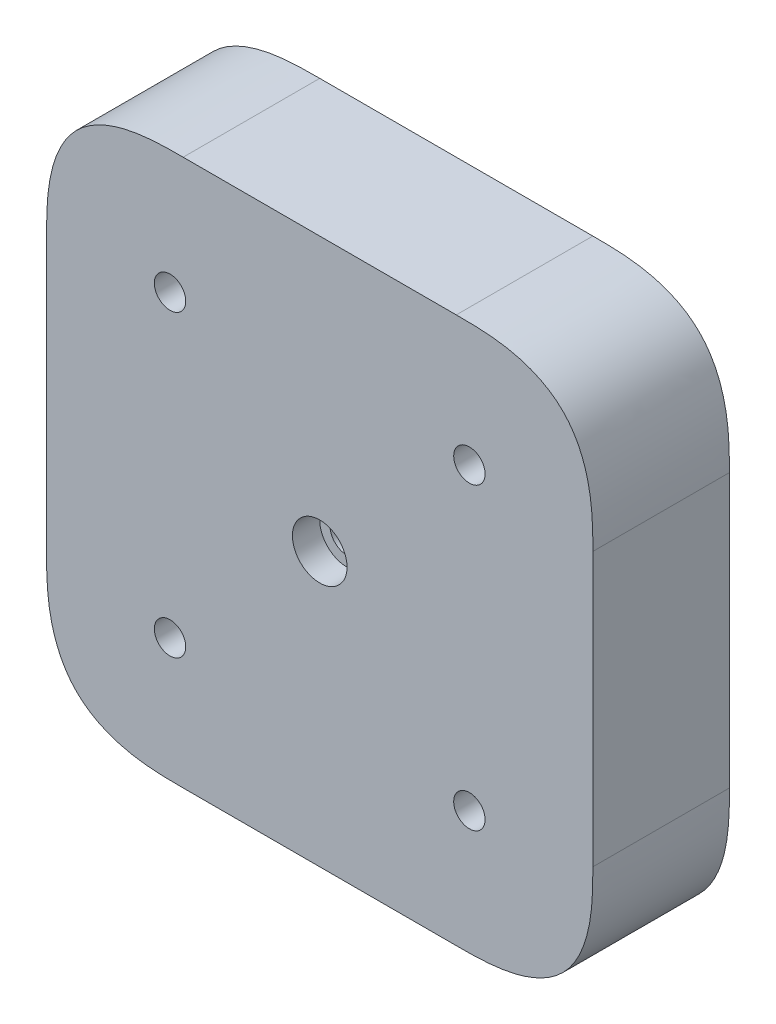
from build123d import *

# Parameters (mm, degrees)
ESQUISSE1_W             = 40
ESQUISSE1_H             = 40
ESQUISSE1_R             = 2
BOSS_EXTRU_1_DEPTH      = 10
ESQUISSE1_3_R           = 2
ESQUISSE1_3_R_2         = 1.25
BOSS_EXTRU_2_DEPTH      = 8
ENL_V_MAT_EXTRU_1_REACH = 59.446
ESQUISSE2_R             = 1.15
ESQUISSE2_5_R           = 3
ESQUISSE2_5_R_2         = 1.15
ENL_V_MAT_EXTRU_2_DEPTH = 4
CONG_1_SIZE             = 10


with BuildPart() as part:
    # Esquisse1 → Boss.-Extru.1 (new body)
    with BuildSketch(Plane.XY):
        with Locations((20, 20)):
            Rectangle(ESQUISSE1_W, ESQUISSE1_H)
        with Locations((20, 20)):
            Circle(ESQUISSE1_R, mode=Mode.SUBTRACT)
    extrude(amount=BOSS_EXTRU_1_DEPTH)

    # Esquisse1<3> → Boss.-Extru.2 (add)
    with BuildSketch(Plane.XY):
        with Locations((20, 20)):
            Circle(ESQUISSE1_3_R)
        with Locations((20, 20)):
            Circle(ESQUISSE1_3_R_2, mode=Mode.SUBTRACT)
    extrude(amount=BOSS_EXTRU_2_DEPTH)

    # Esquisse2 → Enlèv. mat.-Extru.1 (cut, up to next)
    with BuildSketch(Plane(origin=(0, 0, 0), x_dir=(-1, 0, 0), z_dir=(0, 0, -1)), mode=Mode.PRIVATE) as enl_v_mat_extru_1_sk1:
        with Locations((-9.039844892, 30.960155108)):
            Circle(ESQUISSE2_R)
    enl_v_mat_extru_1_tool1 = extrude(enl_v_mat_extru_1_sk1.sketch, amount=-ENL_V_MAT_EXTRU_1_REACH, mode=Mode.PRIVATE) & part.part
    # Esquisse2 → Enlèv. mat.-Extru.1 (cut, up to next)
    with BuildSketch(Plane(origin=(0, 0, 0), x_dir=(-1, 0, 0), z_dir=(0, 0, -1)), mode=Mode.PRIVATE) as enl_v_mat_extru_1_sk2:
        with Locations((-9.039844892, 9.039844892)):
            Circle(ESQUISSE2_R)
    enl_v_mat_extru_1_tool2 = extrude(enl_v_mat_extru_1_sk2.sketch, amount=-ENL_V_MAT_EXTRU_1_REACH, mode=Mode.PRIVATE) & part.part
    # Esquisse2 → Enlèv. mat.-Extru.1 (cut, up to next)
    with BuildSketch(Plane(origin=(0, 0, 0), x_dir=(-1, 0, 0), z_dir=(0, 0, -1)), mode=Mode.PRIVATE) as enl_v_mat_extru_1_sk3:
        with Locations((-30.960155108, 9.039844892)):
            Circle(ESQUISSE2_R)
    enl_v_mat_extru_1_tool3 = extrude(enl_v_mat_extru_1_sk3.sketch, amount=-ENL_V_MAT_EXTRU_1_REACH, mode=Mode.PRIVATE) & part.part
    # Esquisse2 → Enlèv. mat.-Extru.1 (cut, up to next)
    with BuildSketch(Plane(origin=(0, 0, 0), x_dir=(-1, 0, 0), z_dir=(0, 0, -1)), mode=Mode.PRIVATE) as enl_v_mat_extru_1_sk4:
        with Locations((-30.960155108, 30.960155108)):
            Circle(ESQUISSE2_R)
    enl_v_mat_extru_1_tool4 = extrude(enl_v_mat_extru_1_sk4.sketch, amount=-ENL_V_MAT_EXTRU_1_REACH, mode=Mode.PRIVATE) & part.part
    add(enl_v_mat_extru_1_tool1.solids().sort_by_distance((9.039845, 30.960155, 0))[0], mode=Mode.SUBTRACT)
    add(enl_v_mat_extru_1_tool2.solids().sort_by_distance((9.039845, 9.039845, 0))[0], mode=Mode.SUBTRACT)
    add(enl_v_mat_extru_1_tool3.solids().sort_by_distance((30.960155, 9.039845, 0))[0], mode=Mode.SUBTRACT)
    add(enl_v_mat_extru_1_tool4.solids().sort_by_distance((30.960155, 30.960155, 0))[0], mode=Mode.SUBTRACT)

    # Esquisse2<5> → Enlèv. mat.-Extru.2 (cut)
    # profile 1 of 4: a face of its own
    with BuildSketch(Plane(origin=(0, 0, 0), x_dir=(-1, 0, 0), z_dir=(0, 0, -1))):
        with Locations((-9.039844892, 30.960155108)):
            Circle(ESQUISSE2_5_R)
        with Locations((-9.039844892, 30.960155108)):
            Circle(ESQUISSE2_5_R_2, mode=Mode.SUBTRACT)
    # profile 2 of 4: a face of its own
    with BuildSketch(Plane(origin=(0, 0, 0), x_dir=(-1, 0, 0), z_dir=(0, 0, -1))):
        with Locations((-9.039844892, 9.039844892)):
            Circle(ESQUISSE2_5_R)
        with Locations((-9.039844892, 9.039844892)):
            Circle(ESQUISSE2_5_R_2, mode=Mode.SUBTRACT)
    # profile 3 of 4: a face of its own
    with BuildSketch(Plane(origin=(0, 0, 0), x_dir=(-1, 0, 0), z_dir=(0, 0, -1))):
        with Locations((-30.960155108, 9.039844892)):
            Circle(ESQUISSE2_5_R)
        with Locations((-30.960155108, 9.039844892)):
            Circle(ESQUISSE2_5_R_2, mode=Mode.SUBTRACT)
    # profile 4 of 4: a face of its own
    with BuildSketch(Plane(origin=(0, 0, 0), x_dir=(-1, 0, 0), z_dir=(0, 0, -1))):
        with Locations((-30.960155108, 30.960155108)):
            Circle(ESQUISSE2_5_R)
        with Locations((-30.960155108, 30.960155108)):
            Circle(ESQUISSE2_5_R_2, mode=Mode.SUBTRACT)
    extrude(amount=-ENL_V_MAT_EXTRU_2_DEPTH, mode=Mode.SUBTRACT)

    # Congé1
    # a fillet whose section is not a circle: 10 mm, written as the material it takes off along each edge
    with BuildSketch(Plane(origin=(0, 0, -25), x_dir=(1, 0, 0), z_dir=(0, 0, 1)), Plane(origin=(0, 40, -25), x_dir=(0, -1, 0), z_dir=(0, 0, 1))) as cong_1_piece_1:
        with BuildLine():
            add(Edge.make_bspline([(CONG_1_SIZE, 0), (CONG_1_SIZE * 0.831801948466, 0), (CONG_1_SIZE * 0.663603896932, 0), (CONG_1_SIZE * 0.292893218813, CONG_1_SIZE * 0.0716919198361), (CONG_1_SIZE * 0.0716919198361, CONG_1_SIZE * 0.292893218813), (0, CONG_1_SIZE * 0.663603896932), (0, CONG_1_SIZE * 0.831801948466), (0, CONG_1_SIZE)], knots=[0, 0, 0, 0, 0, 0, 0.5, 0.5, 1, 1, 1, 1, 1, 1], degree=5))
            Line((0, CONG_1_SIZE), (0, 0))
            Line((0, 0), (CONG_1_SIZE, 0))
        make_face()
    extrude(amount=60, mode=Mode.SUBTRACT)
    with BuildSketch(Plane(origin=(40, 40, -25), x_dir=(0, -1, 0), z_dir=(0, 0, 1)), Plane(origin=(40, 0, -25), x_dir=(-1, 0, 0), z_dir=(0, 0, 1))) as cong_1_piece_2:
        with BuildLine():
            add(Edge.make_bspline([(CONG_1_SIZE, 0), (CONG_1_SIZE * 0.831801948466, 0), (CONG_1_SIZE * 0.663603896932, 0), (CONG_1_SIZE * 0.292893218813, -CONG_1_SIZE * 0.0716919198361), (CONG_1_SIZE * 0.0716919198361, -CONG_1_SIZE * 0.292893218813), (0, -CONG_1_SIZE * 0.663603896932), (0, -CONG_1_SIZE * 0.831801948466), (0, -CONG_1_SIZE)], knots=[0, 0, 0, 0, 0, 0, 0.5, 0.5, 1, 1, 1, 1, 1, 1], degree=5))
            Line((0, -CONG_1_SIZE), (0, 0))
            Line((0, 0), (CONG_1_SIZE, 0))
        make_face()
    extrude(amount=60, mode=Mode.SUBTRACT)


solid = part.part
